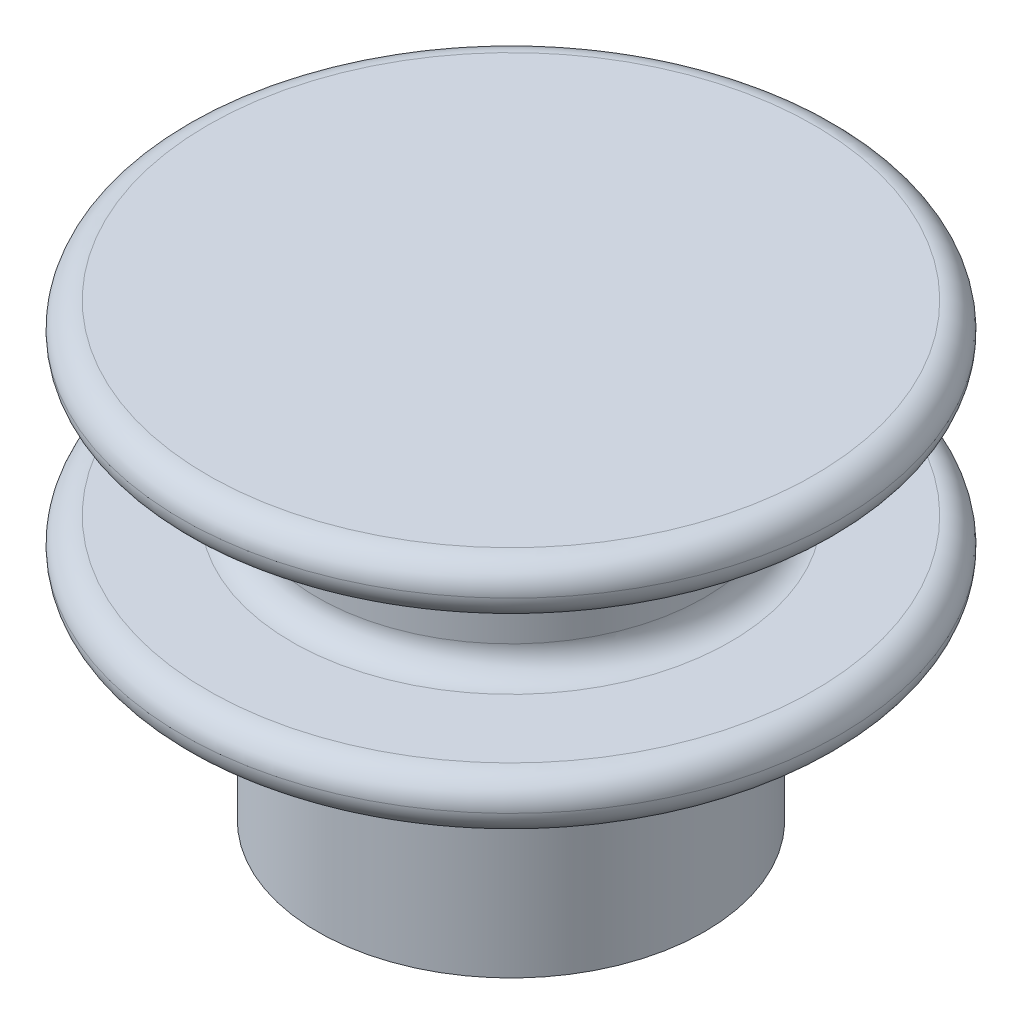
from build123d import *

# Parameters (mm, degrees)
SKETCH7_R           = 6.5
BOSS_EXTRUDE2_DEPTH = 1.5875
FILLET1_R           = 0.79375
BOSS_EXTRUDE1_START = 5
SKETCH6_R           = 6
BOSS_EXTRUDE1_DEPTH = 5
SKETCH5_R           = 1.651
CUT_EXTRUDE3_DEPTH  = 8.89


with BuildPart() as part:
    # Sketch2 → Revolve1 (revolve)
    with BuildSketch(Plane.XY):
        Polygon((0, 3.683), (10.191, 3.683), (10.191, 2.0955), (6, 2.0955), (6, -2.0955), (10.191, -2.0955), (10.191, -3.683), (0, -3.683), align=None)
    revolve(axis=Axis((0, -3.683, 0), (0, 1, 0)))

    # Sketch7 → Boss-Extrude2 (add)
    with BuildSketch(Plane(origin=(0, -3.683, 0), x_dir=(-1, 0, 0), z_dir=(0, -1, 0))):
        with Locations(Location((0, 0, 0), (0, 0, 180))):
            Circle(SKETCH7_R)
    extrude(amount=BOSS_EXTRUDE2_DEPTH)

    # Fillet1
    fillet1_edges = [part.edges().sort_by_distance(p)[0] for p in [
        (-10.191, 2.0955, 0),
        (-6.5, -3.683, 0),
        (-10.191, 3.683, 0),
        (-10.191, -3.683, 0),
        (-10.191, -2.0955, 0),
        (-6, -2.0955, 0),
        (-6, 2.0955, 0),
    ]]
    fillet(fillet1_edges, radius=FILLET1_R - 0.0001)  # a hair under: the kernel refuses the full size

    # Sketch6 → Boss-Extrude1 (add)
    with BuildSketch(Plane.XZ.offset(5.2705).offset(BOSS_EXTRUDE1_START)):
        Circle(SKETCH6_R)
    extrude(amount=-BOSS_EXTRUDE1_DEPTH)

    # Sketch5 → Cut-Extrude3 (cut)
    with BuildSketch(Plane.XZ.offset(10.2705)):
        with Locations((-1.7145, 0)):
            Circle(SKETCH5_R)
        with Locations((1.7145, 0)):
            Circle(SKETCH5_R)
    extrude(amount=-CUT_EXTRUDE3_DEPTH, mode=Mode.SUBTRACT)


solid = part.part
